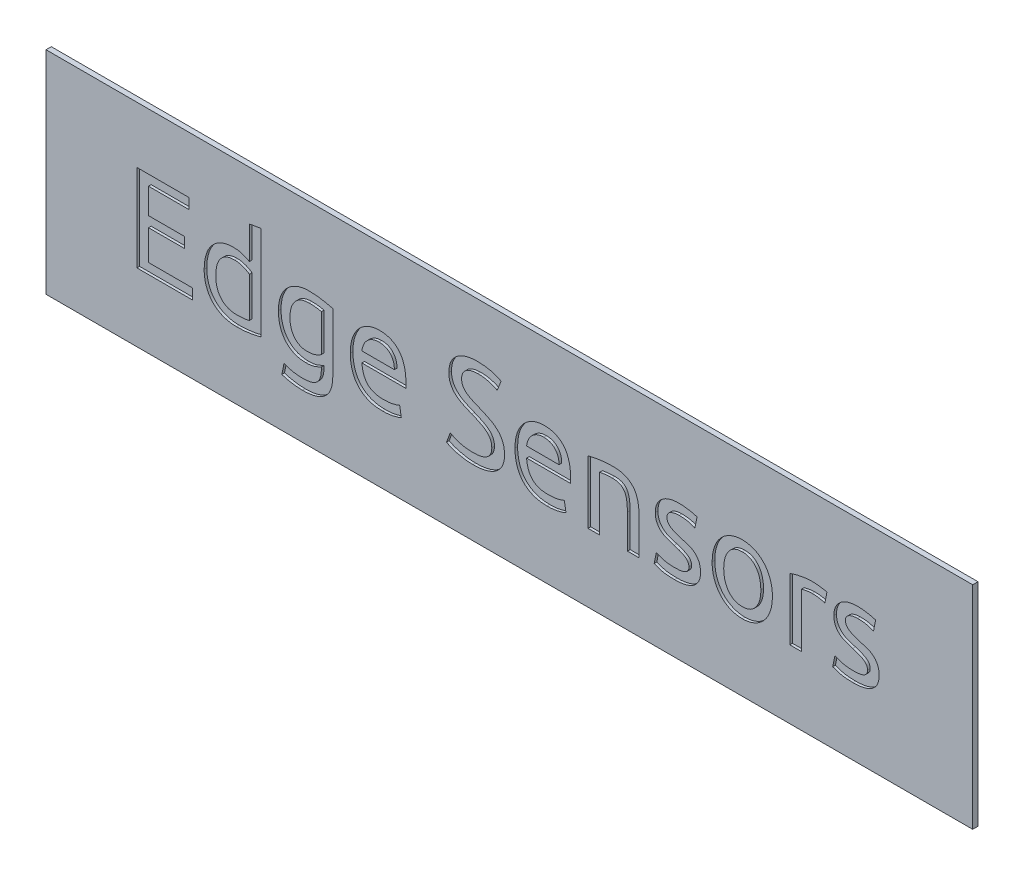
from build123d import *

# Parameters (mm, degrees)
SKETCH1_W           = 35
SKETCH1_H           = 8
BOSS_EXTRUDE1_DEPTH = 0.1
CUT_EXTRUDE4_DEPTH  = 0.1


with BuildPart() as part:
    # Sketch1 → Boss-Extrude1 (new, symmetric)
    with BuildSketch(Plane.XY):
        Rectangle(SKETCH1_W, SKETCH1_H)
    extrude(amount=BOSS_EXTRUDE1_DEPTH, both=True)

    # Sketch5 → Cut-Extrude4 (cut)
    # profile 1 of 11: a face of its own
    with BuildSketch(Plane.XY.offset(0.1)):
        Polygon((-14.067041447, -1.419015965), (-14.067041447, 1.866050701), (-12.096001447, 1.866050701), (-12.096001447, 1.471842701), (-13.629032559, 1.471842701), (-13.629032559, 0.508223146), (-12.271205003, 0.508223146), (-12.271205003, 0.114015146), (-13.629032559, 0.114015146), (-13.629032559, -1.024807965), (-11.964598781, -1.024807965), (-11.964598781, -1.419015965), align=None)
    # profile 2 of 11: a face of its own
    with BuildSketch(Plane.XY.offset(0.1)):
        with BuildLine():
            Line((-9.818355225, 2.141859424), (-9.380346336, 2.216457813))
            Line((-9.380346336, 2.216457813), (-9.380346336, -1.334836132))
            add(Edge.make_bspline(
                [(-9.380346336, -1.334836132), (-9.406991477, -1.342091811), (-9.463700055, -1.357533998), (-9.554735312, -1.37809044), (-9.656080821, -1.400420842), (-9.76759575, -1.421439016), (-9.888862732, -1.440554961), (-10.019372157, -1.45276812), (-10.158607818, -1.461446403), (-10.254296014, -1.462350919), (-10.303586947, -1.462816854)],
                knots=[0, 0, 0, 0, 0.708696399, 1.508311213, 2.394904626, 3.372161166, 4.420519196, 5.544381262, 6.735060893, 8, 8, 8, 8], degree=3))
            add(Edge.make_bspline(
                [(-10.303586947, -1.462816854), (-10.349258874, -1.461792162), (-10.438628961, -1.45978706), (-10.569345458, -1.443309992), (-10.692914742, -1.4149353), (-10.809763859, -1.377207436), (-10.918074268, -1.327372025), (-11.018879606, -1.268970343), (-11.111757832, -1.201259977), (-11.195480056, -1.123144953), (-11.271326454, -1.036884911), (-11.337279234, -0.940535125), (-11.394753972, -0.835849387), (-11.442923043, -0.722211876), (-11.480369392, -0.600416619), (-11.50669768, -0.470895455), (-11.523691085, -0.33425354), (-11.525608508, -0.240550571), (-11.526589892, -0.192591076)],
                knots=[0, 0, 0, 0, 1.100381898, 2.153209509, 3.16810763, 4.152085715, 5.106628803, 6.035383186, 6.955720103, 7.86991209, 8.789427673, 9.718116972, 10.677665349, 11.663009293, 12.687215338, 13.742752196, 14.844684807, 16, 16, 16, 16], degree=3))
            add(Edge.make_bspline(
                [(-11.526589892, -0.192591076), (-11.525651545, -0.146930302), (-11.523808065, -0.057224978), (-11.509860627, 0.07431348), (-11.487385608, 0.200163974), (-11.456087502, 0.319959747), (-11.415974246, 0.433049588), (-11.366738453, 0.53808696), (-11.308678987, 0.634654), (-11.243139998, 0.723360076), (-11.16870611, 0.803179781), (-11.086570465, 0.874053206), (-10.995749196, 0.934609417), (-10.89772179, 0.98612606), (-10.791802378, 1.027473617), (-10.67813909, 1.056909069), (-10.557097006, 1.073921706), (-10.474053478, 1.076378026), (-10.43156767, 1.077634701)],
                knots=[0, 0, 0, 0, 1.158390498, 2.275778191, 3.352141991, 4.39952402, 5.413834168, 6.392623011, 7.337677041, 8.268459554, 9.185881164, 10.101273583, 11.014760688, 11.94944075, 12.906122965, 13.893110212, 14.922096437, 16, 16, 16, 16], degree=3))
            add(Edge.make_bspline(
                [(-10.43156767, 1.077634701), (-10.397312192, 1.077099396), (-10.33089468, 1.076061499), (-10.234364461, 1.064560456), (-10.144011499, 1.047390576), (-10.060869951, 1.022338665), (-9.986359292, 0.994474692), (-9.920682181, 0.967165792), (-9.865430303, 0.940423489), (-9.833066984, 0.920891477), (-9.818355225, 0.91201259)],
                knots=[0, 0, 0, 0, 1.277617102, 2.477155621, 3.622424881, 4.705248139, 5.712558621, 6.590029649, 7.359053847, 8, 8, 8, 8], degree=3))
            Line((-9.818355225, 0.91201259), (-9.818355225, 2.141859424))
        make_face()
        with BuildLine():
            add(Edge.make_bspline(
                [(-9.818355225, 0.494535368), (-9.832961928, 0.505810652), (-9.864185806, 0.529913156), (-9.918675938, 0.561157423), (-9.98137687, 0.592931675), (-10.051839337, 0.623140797), (-10.128448821, 0.649814214), (-10.209605018, 0.670236967), (-10.294870596, 0.680715466), (-10.352838744, 0.682513262), (-10.38229167, 0.683426701)],
                knots=[0, 0, 0, 0, 0.731119519, 1.562870647, 2.485482577, 3.519124939, 4.600761002, 5.700226916, 6.831512668, 8, 8, 8, 8], degree=3))
            add(Edge.make_bspline(
                [(-10.38229167, 0.683426701), (-10.412904234, 0.682695652), (-10.471887259, 0.681287095), (-10.557131567, 0.66888547), (-10.635545468, 0.647833083), (-10.707076274, 0.618152319), (-10.772153915, 0.581658718), (-10.830606025, 0.538220486), (-10.883037348, 0.488627098), (-10.92918549, 0.432749997), (-10.968927875, 0.370834811), (-11.002388952, 0.303193108), (-11.030672842, 0.230441503), (-11.052120447, 0.152363745), (-11.068353045, 0.070412122), (-11.079688436, -0.014869379), (-11.087798722, -0.102780225), (-11.088318542, -0.16245893), (-11.088581003, -0.192591076)],
                knots=[0, 0, 0, 0, 1.147439195, 2.210838474, 3.221454076, 4.184157588, 5.107280873, 6.012351792, 6.907912923, 7.807143567, 8.723064634, 9.660348284, 10.632582249, 11.645476174, 12.692334412, 13.763003241, 14.870526556, 16, 16, 16, 16], degree=3))
            add(Edge.make_bspline(
                [(-11.088581003, -0.192591076), (-11.087882326, -0.22660153), (-11.086524272, -0.29270943), (-11.07720459, -0.389148272), (-11.060076493, -0.479296757), (-11.036664351, -0.563522247), (-11.007523785, -0.642279547), (-10.9705201, -0.714685039), (-10.926954435, -0.781264862), (-10.877097649, -0.841390879), (-10.821399663, -0.894925218), (-10.761146567, -0.941674309), (-10.696081983, -0.980989416), (-10.626847181, -1.013295576), (-10.552844906, -1.037973099), (-10.474654229, -1.05551116), (-10.391982486, -1.06697315), (-10.335336463, -1.068054849), (-10.306324503, -1.068608854)],
                knots=[0, 0, 0, 0, 1.227205659, 2.38538394, 3.491277341, 4.533808097, 5.536752352, 6.516006916, 7.46121355, 8.402397093, 9.328045612, 10.243499414, 11.148419069, 12.06542593, 12.994727378, 13.957231768, 14.953771049, 16, 16, 16, 16], degree=3))
            add(Edge.make_bspline(
                [(-10.306324503, -1.068608854), (-10.277580166, -1.068226968), (-10.222588358, -1.067496368), (-10.143576601, -1.065273311), (-10.072170126, -1.059559139), (-10.007804, -1.052779841), (-9.950732741, -1.044742972), (-9.900414787, -1.035467243), (-9.856821189, -1.027296427), (-9.830408442, -1.019948471), (-9.818355225, -1.016595299)],
                knots=[0, 0, 0, 0, 1.402022376, 2.682258534, 3.853849158, 4.89450926, 5.838561319, 6.663519747, 7.390109408, 8, 8, 8, 8], degree=3))
            Line((-9.818355225, -1.016595299), (-9.818355225, 0.494535368))
        make_face(mode=Mode.SUBTRACT)
    # profile 3 of 11: a face of its own
    with BuildSketch(Plane.XY.offset(0.1)):
        with BuildLine():
            add(Edge.make_bspline(
                [(-7.102700114, -1.175373521), (-7.113794957, -1.182136929), (-7.139704013, -1.197931072), (-7.186372582, -1.220822164), (-7.246420822, -1.24551569), (-7.317019888, -1.27443069), (-7.397795487, -1.300729877), (-7.487043837, -1.317493755), (-7.582328494, -1.330088378), (-7.648339219, -1.330963126), (-7.682377503, -1.331414187)],
                knots=[0, 0, 0, 0, 0.512896486, 1.197733363, 2.049348542, 3.076406364, 4.210256445, 5.395641772, 6.657068461, 8, 8, 8, 8], degree=3))
            add(Edge.make_bspline(
                [(-7.682377503, -1.331414187), (-7.71778773, -1.330773155), (-7.787743307, -1.329506748), (-7.890724839, -1.314976863), (-7.990623986, -1.29325059), (-8.087169299, -1.262783889), (-8.178869395, -1.222277955), (-8.265442063, -1.172980417), (-8.345099749, -1.112595031), (-8.419325507, -1.043436307), (-8.486775443, -0.964320257), (-8.545914217, -0.87540291), (-8.599288296, -0.778481769), (-8.643821754, -0.671607977), (-8.679295734, -0.554709627), (-8.705336398, -0.427620525), (-8.720083516, -0.289893286), (-8.722224293, -0.194679509), (-8.723333003, -0.145368243)],
                knots=[0, 0, 0, 0, 0.952404005, 1.88154606, 2.793260483, 3.70201361, 4.600986056, 5.486692861, 6.376984673, 7.284886975, 8.212587539, 9.167935918, 10.154347991, 11.186333508, 12.277862821, 13.437467191, 14.672862889, 16, 16, 16, 16], degree=3))
            add(Edge.make_bspline(
                [(-8.723333003, -0.145368243), (-8.722547895, -0.101514167), (-8.721009595, -0.015588664), (-8.704931533, 0.110391805), (-8.681850056, 0.231080505), (-8.647277846, 0.345787667), (-8.603681027, 0.454017124), (-8.550880118, 0.554845751), (-8.489663468, 0.648306322), (-8.418884291, 0.733409018), (-8.339324428, 0.810099827), (-8.251519443, 0.878525), (-8.155548426, 0.93825189), (-8.050809769, 0.988190368), (-7.938850184, 1.028707194), (-7.819293145, 1.057378473), (-7.693160918, 1.074784471), (-7.606695282, 1.076672209), (-7.562609447, 1.077634701)],
                knots=[0, 0, 0, 0, 1.107194599, 2.169382222, 3.203497529, 4.208095951, 5.190481787, 6.146795724, 7.078626211, 8.007583288, 8.93680845, 9.864781888, 10.814667073, 11.786397115, 12.79079717, 13.816722995, 14.886822624, 16, 16, 16, 16], degree=3))
            add(Edge.make_bspline(
                [(-7.562609447, 1.077634701), (-7.514234287, 1.0771371), (-7.420831432, 1.076176329), (-7.285367241, 1.068041418), (-7.159465514, 1.053959215), (-7.043019692, 1.033670766), (-6.935948926, 1.010975029), (-6.837349458, 0.991239061), (-6.748138884, 0.970154313), (-6.691608934, 0.956730397), (-6.664691225, 0.950338368)],
                knots=[0, 0, 0, 0, 1.276311119, 2.464304051, 3.579038617, 4.617095577, 5.581550006, 6.466934451, 7.270004451, 8, 8, 8, 8], degree=3))
            Line((-6.664691225, 0.950338368), (-6.664691225, -1.226018299))
            add(Edge.make_bspline(
                [(-6.664691225, -1.226018299), (-6.665698545, -1.271212963), (-6.667651407, -1.35883058), (-6.680129758, -1.485542418), (-6.703011612, -1.602424285), (-6.733153014, -1.710105143), (-6.773807717, -1.807854242), (-6.822919275, -1.896234424), (-6.881931488, -1.974473877), (-6.949494824, -2.043585368), (-7.026375866, -2.103446401), (-7.112024988, -2.155205407), (-7.207323547, -2.198160831), (-7.311678067, -2.233503877), (-7.424971639, -2.261571079), (-7.547439683, -2.281143662), (-7.679188595, -2.292689107), (-7.77018339, -2.294234968), (-7.817202114, -2.295033743)],
                knots=[0, 0, 0, 0, 1.19659051, 2.319796202, 3.365696097, 4.346291985, 5.274999128, 6.161979613, 7.015981777, 7.861613903, 8.713392099, 9.588636043, 10.504847559, 11.475103481, 12.501944304, 13.591169753, 14.755312055, 16, 16, 16, 16], degree=3))
            add(Edge.make_bspline(
                [(-7.817202114, -2.295033743), (-7.854403412, -2.294781814), (-7.927746028, -2.294285134), (-8.03593777, -2.286092621), (-8.141041745, -2.274857034), (-8.242372035, -2.258357662), (-8.338755939, -2.238353048), (-8.429267339, -2.217435093), (-8.513143904, -2.19433857), (-8.566226343, -2.176416011), (-8.591930336, -2.16773741)],
                knots=[0, 0, 0, 0, 1.13179536, 2.2313424, 3.300059131, 4.347802743, 5.353965189, 6.295287988, 7.174531036, 8, 8, 8, 8], degree=3))
            Line((-8.591930336, -2.16773741), (-8.511856836, -1.768738687))
            add(Edge.make_bspline(
                [(-8.511856836, -1.768738687), (-8.489347507, -1.777387017), (-8.442456081, -1.795403213), (-8.36778667, -1.819288808), (-8.286010406, -1.840578814), (-8.198535614, -1.862489041), (-8.10591905, -1.879019564), (-8.010236394, -1.891457082), (-7.912684059, -1.899107338), (-7.846872292, -1.900250784), (-7.81378017, -1.900825743)],
                knots=[0, 0, 0, 0, 0.80989454, 1.687171991, 2.631470454, 3.648147206, 4.715322053, 5.789380466, 6.888434464, 8, 8, 8, 8], degree=3))
            add(Edge.make_bspline(
                [(-7.81378017, -1.900825743), (-7.783417949, -1.900594482), (-7.724644156, -1.900146818), (-7.63990593, -1.892125108), (-7.561373859, -1.880980935), (-7.489783774, -1.864570127), (-7.424396105, -1.844363029), (-7.366269192, -1.81822681), (-7.314168059, -1.788027905), (-7.268290087, -1.752906303), (-7.22883683, -1.71191504), (-7.195168875, -1.665424937), (-7.166159712, -1.613863075), (-7.143137272, -1.556447863), (-7.124522346, -1.493953012), (-7.111746405, -1.425841642), (-7.104322083, -1.352339968), (-7.103252787, -1.301546981), (-7.102700114, -1.275294299)],
                knots=[0, 0, 0, 0, 1.328936581, 2.572494385, 3.723885676, 4.799830186, 5.78550224, 6.715595853, 7.584219763, 8.417427248, 9.236928635, 10.066114273, 10.924801483, 11.820795655, 12.76900571, 13.77601101, 14.850516998, 16, 16, 16, 16], degree=3))
            Line((-7.102700114, -1.275294299), (-7.102700114, -1.175373521))
        make_face()
        with BuildLine():
            add(Edge.make_bspline(
                [(-7.102700114, 0.631413146), (-7.114300686, 0.634743111), (-7.139153203, 0.64187707), (-7.179727108, 0.650304417), (-7.225504006, 0.659448257), (-7.277565684, 0.667513062), (-7.337015288, 0.675684744), (-7.405396975, 0.679533229), (-7.483173836, 0.683564709), (-7.538191925, 0.68347456), (-7.56740017, 0.683426701)],
                knots=[0, 0, 0, 0, 0.617145358, 1.322143002, 2.118560834, 3.00488278, 4.016610172, 5.186386036, 6.506296302, 8, 8, 8, 8], degree=3))
            add(Edge.make_bspline(
                [(-7.56740017, 0.683426701), (-7.595271266, 0.682858093), (-7.649871209, 0.681744179), (-7.729165245, 0.670468359), (-7.803533394, 0.652909841), (-7.872945907, 0.628044669), (-7.937336366, 0.595956984), (-7.996709398, 0.556470847), (-8.051399849, 0.510305797), (-8.100244649, 0.456779756), (-8.144223893, 0.397951643), (-8.181860646, 0.333726597), (-8.214138586, 0.265303543), (-8.240185289, 0.191890708), (-8.260715075, 0.114074504), (-8.274682625, 0.031599071), (-8.284088868, -0.055267258), (-8.284904657, -0.114772321), (-8.285324114, -0.145368243)],
                knots=[0, 0, 0, 0, 1.07736104, 2.110568209, 3.090722823, 4.028499335, 4.9557985, 5.86615153, 6.780131903, 7.716745435, 8.662622766, 9.615960654, 10.590898784, 11.584464587, 12.624580909, 13.699482217, 14.817134912, 16, 16, 16, 16], degree=3))
            add(Edge.make_bspline(
                [(-8.285324114, -0.145368243), (-8.284653115, -0.178926271), (-8.283358408, -0.243677209), (-8.273884859, -0.337096649), (-8.257775288, -0.423094371), (-8.234425242, -0.50139149), (-8.205387139, -0.572485615), (-8.171930509, -0.637258964), (-8.133395906, -0.695566371), (-8.091117701, -0.748001269), (-8.044132186, -0.793302244), (-7.993974479, -0.832667799), (-7.94022511, -0.865659043), (-7.883403732, -0.892629922), (-7.824036045, -0.91179085), (-7.763916814, -0.926467284), (-7.702973391, -0.935793471), (-7.661878232, -0.93673503), (-7.64131417, -0.937206187)],
                knots=[0, 0, 0, 0, 1.401586587, 2.704391556, 3.917284393, 5.05088594, 6.110844842, 7.120973542, 8.090930264, 9.025558841, 9.928562871, 10.811123483, 11.683855142, 12.557730551, 13.431605959, 14.284446384, 15.141535107, 16, 16, 16, 16], degree=3))
            add(Edge.make_bspline(
                [(-7.64131417, -0.937206187), (-7.613465472, -0.936433955), (-7.5587676, -0.934917208), (-7.478503213, -0.92640443), (-7.402003722, -0.910085508), (-7.329337088, -0.889428159), (-7.262385501, -0.863375691), (-7.201933452, -0.835461662), (-7.148630514, -0.805760842), (-7.11754251, -0.782628288), (-7.102700114, -0.771584076)],
                knots=[0, 0, 0, 0, 1.166470035, 2.291073993, 3.374005261, 4.438234581, 5.451280332, 6.378729272, 7.225954136, 8, 8, 8, 8], degree=3))
            Line((-7.102700114, -0.771584076), (-7.102700114, 0.631413146))
        make_face(mode=Mode.SUBTRACT)
    # profile 4 of 11: a face of its own
    with BuildSketch(Plane.XY.offset(0.1)):
        with BuildLine():
            add(Edge.make_bspline(
                [(-6.007677892, -0.177534521), (-6.006815491, -0.124778842), (-6.005137651, -0.022140245), (-5.986798466, 0.126189044), (-5.958568534, 0.264517864), (-5.917926008, 0.391994967), (-5.867945235, 0.509445038), (-5.80975158, 0.616350998), (-5.744563354, 0.713174084), (-5.671492256, 0.799157803), (-5.59206818, 0.875222031), (-5.506703614, 0.941601783), (-5.415257062, 0.997284487), (-5.318561849, 1.042079849), (-5.218733879, 1.077922153), (-5.116887473, 1.102942401), (-5.013766467, 1.118902284), (-4.944651843, 1.120588286), (-4.909918114, 1.12143559)],
                knots=[0, 0, 0, 0, 1.327468689, 2.582651294, 3.756340375, 4.87702492, 5.944853918, 6.965152771, 7.936836138, 8.878103736, 9.800182896, 10.700818157, 11.595168941, 12.48927997, 13.379379399, 14.261101673, 15.12611224, 16, 16, 16, 16], degree=3))
            add(Edge.make_bspline(
                [(-4.909918114, 1.12143559), (-4.870633692, 1.12056812), (-4.794070107, 1.118877459), (-4.682681035, 1.104224217), (-4.578288583, 1.080542912), (-4.480696198, 1.047081785), (-4.390823975, 1.002706062), (-4.306947451, 0.950197927), (-4.231636625, 0.886284879), (-4.162295457, 0.814118533), (-4.101410156, 0.731417129), (-4.048203157, 0.638749036), (-4.004073886, 0.53569647), (-3.968164762, 0.422817895), (-3.938948195, 0.300302324), (-3.920169281, 0.167402989), (-3.907297531, 0.024612844), (-3.905937674, -0.073932153), (-3.905235225, -0.124836576)],
                knots=[0, 0, 0, 0, 1.031932234, 2.011189882, 2.946219779, 3.841049608, 4.715055488, 5.574821978, 6.434463067, 7.30368639, 8.199298984, 9.125757528, 10.105748839, 11.138933968, 12.23528201, 13.411164626, 14.662710692, 16, 16, 16, 16], degree=3))
            add(Edge.make_bspline(
                [(-3.905235225, -0.124836576), (-3.905247535, -0.135558869), (-3.905275559, -0.159969195), (-3.905017471, -0.198526264), (-3.906053777, -0.239662875), (-3.908730211, -0.266971826), (-3.910025947, -0.280192854)],
                knots=[0, 0, 0, 0, 0.82729231, 1.883410153, 2.975299581, 4, 4, 4, 4], degree=3))
            Line((-3.910025947, -0.280192854), (-5.569669003, -0.280192854))
            add(Edge.make_bspline(
                [(-5.569669003, -0.280192854), (-5.566844219, -0.311487905), (-5.561338549, -0.372483787), (-5.547160559, -0.460847368), (-5.527164207, -0.543355029), (-5.502706304, -0.620079022), (-5.473500039, -0.691141117), (-5.438192565, -0.755768513), (-5.39848502, -0.815219641), (-5.35313468, -0.868789336), (-5.302258095, -0.916921936), (-5.243694179, -0.957236378), (-5.179272599, -0.992568893), (-5.107535068, -1.020220555), (-5.029637324, -1.042172166), (-4.945135182, -1.057888022), (-4.853973235, -1.066399012), (-4.791079342, -1.067857335), (-4.75866817, -1.068608854)],
                knots=[0, 0, 0, 0, 1.175258475, 2.290647397, 3.344218134, 4.348198022, 5.300733437, 6.213401868, 7.098646096, 7.970627488, 8.834089667, 9.710112565, 10.622780996, 11.576806211, 12.579079914, 13.646966454, 14.787408912, 16, 16, 16, 16], degree=3))
            add(Edge.make_bspline(
                [(-4.75866817, -1.068608854), (-4.722379528, -1.068080008), (-4.652457851, -1.067061017), (-4.552171219, -1.059450994), (-4.460544555, -1.047854763), (-4.378596123, -1.029418139), (-4.305850424, -1.009852012), (-4.242613694, -0.989570369), (-4.188451393, -0.971398976), (-4.156540136, -0.956831652), (-4.142033781, -0.950209576)],
                knots=[0, 0, 0, 0, 1.376383924, 2.652043942, 3.81348749, 4.87603448, 5.835393189, 6.67015634, 7.395473989, 8, 8, 8, 8], degree=3))
            Line((-4.142033781, -0.950209576), (-4.080438781, -1.325254687))
            add(Edge.make_bspline(
                [(-4.080438781, -1.325254687), (-4.095853379, -1.332555897), (-4.131040166, -1.349222313), (-4.192690029, -1.371187485), (-4.269053128, -1.39306262), (-4.357804714, -1.41750585), (-4.457699131, -1.437409893), (-4.565744995, -1.452584159), (-4.680497341, -1.461464821), (-4.759337065, -1.462358809), (-4.799731503, -1.462816854)],
                knots=[0, 0, 0, 0, 0.554579956, 1.265935475, 2.125279317, 3.138678044, 4.259297339, 5.435750784, 6.686177434, 8, 8, 8, 8], degree=3))
            add(Edge.make_bspline(
                [(-4.799731503, -1.462816854), (-4.850211616, -1.461729144), (-4.948108732, -1.459619724), (-5.089475025, -1.440705305), (-5.220627264, -1.411114393), (-5.340947899, -1.368676101), (-5.450360029, -1.314612924), (-5.550205938, -1.252413331), (-5.640148214, -1.180863621), (-5.719189048, -1.099306773), (-5.788563764, -1.009528486), (-5.847473586, -0.911019841), (-5.898692383, -0.805569018), (-5.938657731, -0.691507369), (-5.968901196, -0.57085817), (-5.991862529, -0.444716922), (-6.00465026, -0.312851096), (-6.006656458, -0.223186366), (-6.007677892, -0.177534521)],
                knots=[0, 0, 0, 0, 1.208119678, 2.34293118, 3.408190336, 4.422270291, 5.389613311, 6.324666099, 7.233999477, 8.133983449, 9.037490978, 9.944261645, 10.877493988, 11.839765712, 12.832016395, 13.853074316, 14.906915604, 16, 16, 16, 16], degree=3))
        make_face()
        with BuildLine():
            add(Edge.make_bspline(
                [(-4.343244114, 0.114015146), (-4.343362986, 0.135925987), (-4.343595062, 0.178703283), (-4.34961915, 0.241533322), (-4.361689339, 0.301112885), (-4.376891721, 0.358214243), (-4.398357597, 0.412139812), (-4.425436674, 0.462604591), (-4.455928396, 0.51112885), (-4.492461065, 0.555222447), (-4.532482157, 0.596021072), (-4.577445406, 0.630490786), (-4.624679712, 0.661558233), (-4.676872408, 0.685114365), (-4.731933459, 0.704597856), (-4.791079984, 0.717190241), (-4.853315425, 0.725804884), (-4.896198832, 0.726746181), (-4.918130781, 0.72722759)],
                knots=[0, 0, 0, 0, 1.106680256, 2.160610296, 3.182285172, 4.174944244, 5.142324458, 6.106403492, 7.065509454, 8.032134143, 8.993798923, 9.946024503, 10.889209428, 11.843107536, 12.830870189, 13.834707008, 14.892599795, 16, 16, 16, 16], degree=3))
            add(Edge.make_bspline(
                [(-4.918130781, 0.72722759), (-4.942793181, 0.726517131), (-4.990941071, 0.725130117), (-5.061088483, 0.715889443), (-5.126390142, 0.69851087), (-5.187133183, 0.675136468), (-5.242869125, 0.646166494), (-5.29503072, 0.613998823), (-5.342040054, 0.576983184), (-5.384711472, 0.536274179), (-5.423309909, 0.49253104), (-5.456836623, 0.444820328), (-5.486623366, 0.394185738), (-5.518499549, 0.322298105), (-5.551031239, 0.229546464), (-5.563480567, 0.152375874), (-5.569669003, 0.114015146)],
                knots=[0, 0, 0, 0, 1.049935956, 2.049768024, 3.003744765, 3.919900137, 4.814598855, 5.674138501, 6.525021604, 7.3561688, 8.182022917, 9.003870511, 9.835017706, 10.678106637, 12.348720051, 14, 14, 14, 14], degree=3))
            Line((-5.569669003, 0.114015146), (-4.343244114, 0.114015146))
        make_face(mode=Mode.SUBTRACT)
    # profile 5 of 11: a face of its own
    with BuildSketch(Plane.XY.offset(0.1)):
        with BuildLine():
            add(Edge.make_bspline(
                [(-1.372311947, -1.112409743), (-1.343780745, -1.112060325), (-1.288245638, -1.111380193), (-1.20788162, -1.104866426), (-1.132739491, -1.095982206), (-1.063598854, -1.081203594), (-0.999575396, -1.063816009), (-0.941150023, -1.041845684), (-0.888110609, -1.016170041), (-0.841304455, -0.985410917), (-0.798990551, -0.952297927), (-0.762960237, -0.913750394), (-0.732044782, -0.871612878), (-0.707591816, -0.824980381), (-0.686975337, -0.775296186), (-0.673863763, -0.720804178), (-0.665423371, -0.662576678), (-0.664461824, -0.622419038), (-0.663969447, -0.601855632)],
                knots=[0, 0, 0, 0, 1.377492973, 2.681247697, 3.891940251, 5.028431159, 6.092277143, 7.092864452, 8.038832474, 8.931122951, 9.793110516, 10.626971684, 11.47095992, 12.308886602, 13.164018022, 14.061800404, 15.007511787, 16, 16, 16, 16], degree=3))
            add(Edge.make_bspline(
                [(-0.663969447, -0.601855632), (-0.664854633, -0.576505852), (-0.66656198, -0.527611203), (-0.676894577, -0.456945931), (-0.69737593, -0.392804925), (-0.72406453, -0.333809364), (-0.758376041, -0.280203693), (-0.797324905, -0.230246567), (-0.841583848, -0.183657476), (-0.909481685, -0.127044318), (-1.004927701, -0.062076898), (-1.133485266, 0.003517263), (-1.272443604, 0.065491174), (-1.368366766, 0.106183259), (-1.417481614, 0.127018535)],
                knots=[0, 0, 0, 0, 0.811365835, 1.5649622, 2.276000999, 2.95859887, 3.630934483, 4.306944628, 4.983230544, 5.682292857, 7.131827656, 8.666343326, 10.293091724, 12, 12, 12, 12], degree=3))
            add(Edge.make_bspline(
                [(-1.417481614, 0.127018535), (-1.474435282, 0.149923176), (-1.58718076, 0.195265201), (-1.724731012, 0.256770048), (-1.829102869, 0.310369403), (-1.901239292, 0.354482848), (-1.968348343, 0.401622444), (-2.030668951, 0.452086372), (-2.085959463, 0.508117215), (-2.136849233, 0.567488504), (-2.179569604, 0.633356896), (-2.217997216, 0.70326266), (-2.248578663, 0.780075798), (-2.269322655, 0.86457821), (-2.282631495, 0.956302495), (-2.283931765, 1.020096868), (-2.284602336, 1.052996701)],
                knots=[0, 0, 0, 0, 1.881476714, 3.724571196, 4.615906794, 5.475721414, 6.3137665, 7.128471691, 7.929438621, 8.723539643, 9.520590439, 10.330872839, 11.165761655, 12.045919756, 12.992247868, 14, 14, 14, 14], degree=3))
            add(Edge.make_bspline(
                [(-2.284602336, 1.052996701), (-2.283610085, 1.087483121), (-2.281677417, 1.154654396), (-2.268731482, 1.252660745), (-2.246225028, 1.345002535), (-2.213997184, 1.431236467), (-2.173233438, 1.511662649), (-2.123596841, 1.586271747), (-2.064428431, 1.654898105), (-1.996181651, 1.717229579), (-1.920623916, 1.773207948), (-1.837361775, 1.821449176), (-1.747716979, 1.862363583), (-1.651069418, 1.896123512), (-1.547703813, 1.921865132), (-1.437375617, 1.940002143), (-1.320571027, 1.952180795), (-1.2402572, 1.953154332), (-1.199161559, 1.953652479)],
                knots=[0, 0, 0, 0, 1.036936748, 2.019704159, 2.966376421, 3.888880766, 4.781625726, 5.672022014, 6.576782996, 7.499210823, 8.445883085, 9.398871932, 10.387273209, 11.404763735, 12.472884254, 13.585964168, 14.764766231, 16, 16, 16, 16], degree=3))
            add(Edge.make_bspline(
                [(-1.199161559, 1.953652479), (-1.151234444, 1.952816305), (-1.057516548, 1.951181229), (-0.920251767, 1.93981033), (-0.789993808, 1.919106911), (-0.668029723, 1.891382321), (-0.557786373, 1.858699013), (-0.461041592, 1.825907163), (-0.380593293, 1.790423446), (-0.334546358, 1.762451616), (-0.313562336, 1.74970459)],
                knots=[0, 0, 0, 0, 1.25147498, 2.447165896, 3.593012675, 4.692731984, 5.710660103, 6.594242178, 7.359382933, 8, 8, 8, 8], degree=3))
            Line((-0.313562336, 1.74970459), (-0.460021559, 1.379450201))
            add(Edge.make_bspline(
                [(-0.460021559, 1.379450201), (-0.477863438, 1.390058468), (-0.516429113, 1.412988505), (-0.583074922, 1.442392222), (-0.660918398, 1.472389335), (-0.749829466, 1.50152758), (-0.848210126, 1.528029173), (-0.955705152, 1.54577379), (-1.070668108, 1.558035784), (-1.150078384, 1.558965815), (-1.190948892, 1.559444479)],
                knots=[0, 0, 0, 0, 0.653649503, 1.412879949, 2.2914092, 3.282670824, 4.360349048, 5.49858183, 6.712581845, 8, 8, 8, 8], degree=3))
            add(Edge.make_bspline(
                [(-1.190948892, 1.559444479), (-1.23235127, 1.558327583), (-1.313038099, 1.556150925), (-1.428365056, 1.533725583), (-1.533274595, 1.499198938), (-1.60964712, 1.455916072), (-1.663057971, 1.415226438), (-1.698182013, 1.380709422), (-1.729148408, 1.34209004), (-1.755823673, 1.299767917), (-1.777600504, 1.253773121), (-1.791406814, 1.203241621), (-1.801750834, 1.149460416), (-1.802439916, 1.111908664), (-1.802792559, 1.092691257)],
                knots=[0, 0, 0, 0, 1.719475256, 3.350991228, 4.86583626, 6.292971001, 6.9759855, 7.653444794, 8.334876713, 9.02964567, 9.729896761, 10.441301586, 11.202323736, 12, 12, 12, 12], degree=3))
            add(Edge.make_bspline(
                [(-1.802792559, 1.092691257), (-1.802078664, 1.07121681), (-1.800712642, 1.030125917), (-1.791893781, 0.9707488), (-1.776421209, 0.91679619), (-1.754088915, 0.867759428), (-1.725356617, 0.823729737), (-1.692118457, 0.782474766), (-1.654695232, 0.743044589), (-1.59522591, 0.695203001), (-1.510759871, 0.63949618), (-1.396377237, 0.579914775), (-1.268349306, 0.52368525), (-1.178290077, 0.487861895), (-1.131407059, 0.469212979)],
                knots=[0, 0, 0, 0, 0.785038728, 1.502154768, 2.188344236, 2.830229253, 3.464100274, 4.104900842, 4.765475595, 5.446731494, 6.890051486, 8.456936281, 10.155552478, 12, 12, 12, 12], degree=3))
            add(Edge.make_bspline(
                [(-1.131407059, 0.469212979), (-1.065271315, 0.441166513), (-0.937224111, 0.386864991), (-0.782708874, 0.313637937), (-0.667612711, 0.253009921), (-0.588609054, 0.20381841), (-0.516007446, 0.149573034), (-0.449142926, 0.0912627), (-0.388509848, 0.028142242), (-0.334610585, -0.040584608), (-0.288766175, -0.115580317), (-0.250108169, -0.196465598), (-0.218580316, -0.284531416), (-0.1973753, -0.381329202), (-0.18410289, -0.486735558), (-0.182823301, -0.559836846), (-0.18215967, -0.597749299)],
                knots=[0, 0, 0, 0, 1.95273218, 3.780737635, 4.64641346, 5.487847706, 6.307705496, 7.107546074, 7.897078186, 8.683584325, 9.477052339, 10.281471897, 11.117058081, 12.013722982, 12.969858994, 14, 14, 14, 14], degree=3))
            add(Edge.make_bspline(
                [(-0.18215967, -0.597749299), (-0.183043243, -0.633157927), (-0.184766794, -0.702228134), (-0.199250894, -0.802811185), (-0.22376637, -0.896987016), (-0.258434591, -0.984884253), (-0.302106875, -1.066746154), (-0.356206583, -1.141954547), (-0.419674318, -1.211116713), (-0.493238495, -1.272916884), (-0.574723398, -1.328926462), (-0.665575679, -1.3756721), (-0.763191597, -1.417218011), (-0.869786122, -1.44960572), (-0.983605896, -1.475836446), (-1.105932663, -1.492741797), (-1.235632526, -1.5052391), (-1.325055809, -1.506150209), (-1.37094317, -1.506617743)],
                knots=[0, 0, 0, 0, 1.002359664, 1.955263247, 2.87036426, 3.752111736, 4.625011069, 5.490901748, 6.36873565, 7.276165365, 8.206127549, 9.162637605, 10.164476677, 11.20656157, 12.313001129, 13.468736406, 14.701087669, 16, 16, 16, 16], degree=3))
            add(Edge.make_bspline(
                [(-1.37094317, -1.506617743), (-1.432363969, -1.505328579), (-1.550504339, -1.502848924), (-1.719560886, -1.483444675), (-1.87171789, -1.453884779), (-2.007313619, -1.422190881), (-2.124818103, -1.384606695), (-2.211482763, -1.352083063), (-2.271571091, -1.325704073), (-2.309140383, -1.306575498), (-2.342677771, -1.290822921), (-2.362897527, -1.279720187), (-2.372204114, -1.27460991)],
                knots=[0, 0, 0, 0, 1.77521498, 3.414552703, 4.9110395, 6.254623107, 7.437219514, 8.474610623, 8.929266385, 9.333326447, 9.693148859, 10, 10, 10, 10], degree=3))
            Line((-2.372204114, -1.27460991), (-2.234641947, -0.899564799))
            add(Edge.make_bspline(
                [(-2.234641947, -0.899564799), (-2.21445285, -0.910291453), (-2.170180814, -0.933813596), (-2.095184229, -0.966745521), (-2.006715278, -1.002339931), (-1.905093037, -1.039511404), (-1.789850148, -1.072994354), (-1.661347304, -1.095184161), (-1.520945477, -1.110062759), (-1.423228145, -1.111605756), (-1.372311947, -1.112409743)],
                knots=[0, 0, 0, 0, 0.610817719, 1.339442905, 2.18743935, 3.159432638, 4.230564173, 5.389377797, 6.639719769, 8, 8, 8, 8], degree=3))
        make_face()
    # profile 6 of 11: a face of its own
    with BuildSketch(Plane.XY.offset(0.1)):
        with BuildLine():
            add(Edge.make_bspline(
                [(0.21204833, -0.177534521), (0.212910731, -0.124778842), (0.214588571, -0.022140245), (0.232927756, 0.126189044), (0.261157688, 0.264517864), (0.301800214, 0.391994967), (0.351780987, 0.509445038), (0.409974642, 0.616350998), (0.475162868, 0.713174084), (0.548233967, 0.799157803), (0.627658042, 0.875222031), (0.713022608, 0.941601783), (0.80446916, 0.997284487), (0.901164373, 1.042079849), (1.000992343, 1.077922153), (1.10283875, 1.102942401), (1.205959756, 1.118902284), (1.275074379, 1.120588286), (1.309808108, 1.12143559)],
                knots=[0, 0, 0, 0, 1.327468689, 2.582651294, 3.756340375, 4.87702492, 5.944853918, 6.965152771, 7.936836138, 8.878103736, 9.800182896, 10.700818157, 11.595168941, 12.48927997, 13.379379399, 14.261101673, 15.12611224, 16, 16, 16, 16], degree=3))
            add(Edge.make_bspline(
                [(1.309808108, 1.12143559), (1.34909253, 1.12056812), (1.425656115, 1.118877459), (1.537045188, 1.104224217), (1.641437639, 1.080542912), (1.739030024, 1.047081785), (1.828902247, 1.002706062), (1.912778771, 0.950197927), (1.988089597, 0.886284879), (2.057430765, 0.814118533), (2.118316066, 0.731417129), (2.171523066, 0.638749036), (2.215652336, 0.53569647), (2.25156146, 0.422817895), (2.280778027, 0.300302324), (2.299556942, 0.167402989), (2.312428691, 0.024612844), (2.313788549, -0.073932153), (2.314490997, -0.124836576)],
                knots=[0, 0, 0, 0, 1.031932234, 2.011189882, 2.946219779, 3.841049608, 4.715055488, 5.574821978, 6.434463067, 7.30368639, 8.199298984, 9.125757528, 10.105748839, 11.138933968, 12.23528201, 13.411164626, 14.662710692, 16, 16, 16, 16], degree=3))
            add(Edge.make_bspline(
                [(2.314490997, -0.124836576), (2.314478687, -0.135558869), (2.314450664, -0.159969195), (2.314708751, -0.198526264), (2.313672445, -0.239662875), (2.310996011, -0.266971826), (2.309700275, -0.280192854)],
                knots=[0, 0, 0, 0, 0.82729231, 1.883410153, 2.975299581, 4, 4, 4, 4], degree=3))
            Line((2.309700275, -0.280192854), (0.650057219, -0.280192854))
            add(Edge.make_bspline(
                [(0.650057219, -0.280192854), (0.652882003, -0.311487905), (0.658387673, -0.372483787), (0.672565663, -0.460847368), (0.692562015, -0.543355029), (0.717019919, -0.620079022), (0.746226183, -0.691141117), (0.781533657, -0.755768513), (0.821241202, -0.815219641), (0.866591542, -0.868789336), (0.917468127, -0.916921936), (0.976032043, -0.957236378), (1.040453624, -0.992568893), (1.112191154, -1.020220555), (1.190088898, -1.042172166), (1.27459104, -1.057888022), (1.365752987, -1.066399012), (1.428646881, -1.067857335), (1.461058053, -1.068608854)],
                knots=[0, 0, 0, 0, 1.175258475, 2.290647397, 3.344218134, 4.348198022, 5.300733437, 6.213401868, 7.098646096, 7.970627488, 8.834089667, 9.710112565, 10.622780996, 11.576806211, 12.579079914, 13.646966454, 14.787408912, 16, 16, 16, 16], degree=3))
            add(Edge.make_bspline(
                [(1.461058053, -1.068608854), (1.497346694, -1.068080008), (1.567268371, -1.067061017), (1.667555003, -1.059450994), (1.759181667, -1.047854763), (1.841130099, -1.029418139), (1.913875799, -1.009852012), (1.977112528, -0.989570369), (2.03127483, -0.971398976), (2.063186086, -0.956831652), (2.077692441, -0.950209576)],
                knots=[0, 0, 0, 0, 1.376383924, 2.652043942, 3.81348749, 4.87603448, 5.835393189, 6.67015634, 7.395473989, 8, 8, 8, 8], degree=3))
            Line((2.077692441, -0.950209576), (2.139287441, -1.325254687))
            add(Edge.make_bspline(
                [(2.139287441, -1.325254687), (2.123872843, -1.332555897), (2.088686056, -1.349222313), (2.027036193, -1.371187485), (1.950673095, -1.39306262), (1.861921509, -1.41750585), (1.762027092, -1.437409893), (1.653981227, -1.452584159), (1.539228881, -1.461464821), (1.460389158, -1.462358809), (1.419994719, -1.462816854)],
                knots=[0, 0, 0, 0, 0.554579956, 1.265935475, 2.125279317, 3.138678044, 4.259297339, 5.435750784, 6.686177434, 8, 8, 8, 8], degree=3))
            add(Edge.make_bspline(
                [(1.419994719, -1.462816854), (1.369514606, -1.461729144), (1.27161749, -1.459619724), (1.130251197, -1.440705305), (0.999098958, -1.411114393), (0.878778323, -1.368676101), (0.769366193, -1.314612924), (0.669520284, -1.252413331), (0.579578008, -1.180863621), (0.500537174, -1.099306773), (0.431162458, -1.009528486), (0.372252636, -0.911019841), (0.321033839, -0.805569018), (0.281068491, -0.691507369), (0.250825026, -0.57085817), (0.227863693, -0.444716922), (0.215075963, -0.312851096), (0.213069765, -0.223186366), (0.21204833, -0.177534521)],
                knots=[0, 0, 0, 0, 1.208119678, 2.34293118, 3.408190336, 4.422270291, 5.389613311, 6.324666099, 7.233999477, 8.133983449, 9.037490978, 9.944261645, 10.877493988, 11.839765712, 12.832016395, 13.853074316, 14.906915604, 16, 16, 16, 16], degree=3))
        make_face()
        with BuildLine():
            add(Edge.make_bspline(
                [(1.876482108, 0.114015146), (1.876363237, 0.135925987), (1.87613116, 0.178703283), (1.870107072, 0.241533322), (1.858036884, 0.301112885), (1.842834502, 0.358214243), (1.821368625, 0.412139812), (1.794289548, 0.462604591), (1.763797827, 0.51112885), (1.727265157, 0.555222447), (1.687244065, 0.596021072), (1.642280816, 0.630490786), (1.595046511, 0.661558233), (1.542853815, 0.685114365), (1.487792763, 0.704597856), (1.428646238, 0.717190241), (1.366410797, 0.725804884), (1.32352739, 0.726746181), (1.301595441, 0.72722759)],
                knots=[0, 0, 0, 0, 1.106680256, 2.160610296, 3.182285172, 4.174944244, 5.142324458, 6.106403492, 7.065509454, 8.032134143, 8.993798923, 9.946024503, 10.889209428, 11.843107536, 12.830870189, 13.834707008, 14.892599795, 16, 16, 16, 16], degree=3))
            add(Edge.make_bspline(
                [(1.301595441, 0.72722759), (1.276933041, 0.726517131), (1.228785152, 0.725130117), (1.158637739, 0.715889443), (1.09333608, 0.69851087), (1.032593039, 0.675136468), (0.976857097, 0.646166494), (0.924695502, 0.613998823), (0.877686169, 0.576983184), (0.83501475, 0.536274179), (0.796416314, 0.49253104), (0.762889599, 0.444820328), (0.733102857, 0.394185738), (0.701226673, 0.322298105), (0.668694983, 0.229546464), (0.656245655, 0.152375874), (0.650057219, 0.114015146)],
                knots=[0, 0, 0, 0, 1.049935956, 2.049768024, 3.003744765, 3.919900137, 4.814598855, 5.674138501, 6.525021604, 7.3561688, 8.182022917, 9.003870511, 9.835017706, 10.678106637, 12.348720051, 14, 14, 14, 14], degree=3))
            Line((0.650057219, 0.114015146), (1.876482108, 0.114015146))
        make_face(mode=Mode.SUBTRACT)
    # profile 7 of 11: a face of its own
    with BuildSketch(Plane.XY.offset(0.1)):
        with BuildLine():
            add(Edge.make_bspline(
                [(2.97150433, 0.95512909), (2.997939302, 0.961635056), (3.054745907, 0.975615845), (3.146236111, 0.995357277), (3.250011413, 1.014644001), (3.364631799, 1.036639593), (3.490368387, 1.054989646), (3.62574233, 1.068806927), (3.770564745, 1.075937064), (3.870100162, 1.077057058), (3.921436108, 1.077634701)],
                knots=[0, 0, 0, 0, 0.680284324, 1.461875666, 2.338427445, 3.317936278, 4.378115673, 5.512616965, 6.717118313, 8, 8, 8, 8], degree=3))
            add(Edge.make_bspline(
                [(3.921436108, 1.077634701), (3.966891437, 1.076935355), (4.054223723, 1.075591715), (4.17879636, 1.059378911), (4.291851117, 1.034996604), (4.392630865, 0.998057025), (4.482990176, 0.952934703), (4.563584013, 0.898963347), (4.634291841, 0.836429915), (4.695839504, 0.765940979), (4.748088154, 0.687452397), (4.792865001, 0.602126791), (4.827392999, 0.508483553), (4.854751393, 0.408612573), (4.873820683, 0.302436267), (4.888262724, 0.190984195), (4.897411008, 0.074245163), (4.898293782, -0.005507904), (4.898743441, -0.046131854)],
                knots=[0, 0, 0, 0, 1.270490605, 2.440964561, 3.507431799, 4.498454317, 5.434378614, 6.326270354, 7.203202198, 8.066919966, 8.935806928, 9.834745711, 10.755519173, 11.721390489, 12.727517542, 13.769795289, 14.863996961, 16, 16, 16, 16], degree=3))
            Line((4.898743441, -0.046131854), (4.898743441, -1.419015965))
            Line((4.898743441, -1.419015965), (4.460734553, -1.419015965))
            Line((4.460734553, -1.419015965), (4.460734553, -0.145368243))
            add(Edge.make_bspline(
                [(4.460734553, -0.145368243), (4.460328054, -0.109315487), (4.459545435, -0.039904196), (4.453946313, 0.06031555), (4.445553546, 0.152429737), (4.432618761, 0.236576065), (4.415558885, 0.312737264), (4.395026218, 0.381669188), (4.368096006, 0.442460533), (4.336419462, 0.495809134), (4.299959033, 0.542462034), (4.257417452, 0.582053776), (4.20941055, 0.615212106), (4.154887613, 0.640639504), (4.094462166, 0.659481593), (4.02810498, 0.673986805), (3.954710041, 0.681993742), (3.90366085, 0.682934485), (3.87695083, 0.683426701)],
                knots=[0, 0, 0, 0, 1.468089658, 2.826469009, 4.086424813, 5.233471078, 6.290495501, 7.263113516, 8.157324361, 8.990583806, 9.784215768, 10.559808284, 11.348312596, 12.150328132, 12.999388289, 13.921397661, 14.912431199, 16, 16, 16, 16], degree=3))
            add(Edge.make_bspline(
                [(3.87695083, 0.683426701), (3.854134988, 0.683092973), (3.807568012, 0.682411837), (3.737716093, 0.679090593), (3.66841205, 0.67326148), (3.602180389, 0.66754416), (3.540754194, 0.660155725), (3.48719424, 0.651439583), (3.444123717, 0.643378409), (3.419545617, 0.638283522), (3.409513219, 0.636203868)],
                knots=[0, 0, 0, 0, 1.163702551, 2.37510882, 3.565492602, 4.710491206, 5.765406209, 6.719877075, 7.477473773, 8, 8, 8, 8], degree=3))
            Line((3.409513219, 0.636203868), (3.409513219, -1.419015965))
            Line((3.409513219, -1.419015965), (2.97150433, -1.419015965))
            Line((2.97150433, -1.419015965), (2.97150433, 0.95512909))
        make_face()
    # profile 8 of 11: a face of its own
    with BuildSketch(Plane.XY.offset(0.1)):
        with BuildLine():
            add(Edge.make_bspline(
                [(6.242883219, -1.068608854), (6.265012375, -1.068226108), (6.307917503, -1.067484021), (6.370059146, -1.065208131), (6.427596198, -1.059613871), (6.480568516, -1.052079117), (6.529410611, -1.042895734), (6.573551788, -1.030268485), (6.613776203, -1.017139925), (6.659266935, -0.99545702), (6.708397092, -0.963499813), (6.752454231, -0.911536418), (6.777997417, -0.847849503), (6.780751556, -0.802155113), (6.782181664, -0.778427965)],
                knots=[0, 0, 0, 0, 1.15783728, 2.244873574, 3.251859722, 4.180101662, 5.043725828, 5.848624977, 6.580788869, 7.253443454, 8.481479101, 9.616771655, 10.762491124, 12, 12, 12, 12], degree=3))
            add(Edge.make_bspline(
                [(6.782181664, -0.778427965), (6.780718223, -0.753562043), (6.777861369, -0.705020045), (6.752006776, -0.636855173), (6.709993371, -0.57698101), (6.64942393, -0.526448058), (6.571218867, -0.480651226), (6.474909893, -0.434455953), (6.357340711, -0.38980779), (6.271764495, -0.362135052), (6.225773497, -0.347262965)],
                knots=[0, 0, 0, 0, 0.786255881, 1.53488906, 2.277624633, 3.082861666, 4.014797129, 5.147466321, 6.46697041, 8, 8, 8, 8], degree=3))
            add(Edge.make_bspline(
                [(6.225773497, -0.347262965), (6.179248854, -0.332407013), (6.088059003, -0.30328885), (5.975124892, -0.26768246), (5.889707534, -0.234020399), (5.829929821, -0.204255719), (5.775235935, -0.168102706), (5.724128989, -0.128597638), (5.67805471, -0.083790622), (5.636952363, -0.034339393), (5.600637939, 0.019354989), (5.56837759, 0.077306566), (5.542970015, 0.141655972), (5.52467, 0.212407053), (5.513530145, 0.29000658), (5.51249519, 0.343930531), (5.511955886, 0.372029757)],
                knots=[0, 0, 0, 0, 1.843805769, 3.613920779, 4.467868233, 5.3074523, 6.129135207, 6.93881679, 7.742707307, 8.549820213, 9.361925381, 10.186671254, 11.048614442, 11.965587033, 12.939887954, 14, 14, 14, 14], degree=3))
            add(Edge.make_bspline(
                [(5.511955886, 0.372029757), (5.512829647, 0.400121459), (5.514534257, 0.454925214), (5.525366689, 0.535088029), (5.544601727, 0.610566508), (5.571305763, 0.681595073), (5.605917517, 0.747906055), (5.647981154, 0.809870663), (5.697458608, 0.867595495), (5.754419269, 0.920406582), (5.818368396, 0.967242862), (5.887236365, 1.009631497), (5.962865535, 1.043301309), (6.042921273, 1.072629166), (6.129099542, 1.093807426), (6.220164137, 1.110888557), (6.317103107, 1.119132783), (6.383400183, 1.120654922), (6.417402386, 1.12143559)],
                knots=[0, 0, 0, 0, 1.016902755, 1.983862999, 2.921173698, 3.830644198, 4.724459732, 5.622271565, 6.535856491, 7.470763359, 8.427015907, 9.401352539, 10.391620572, 11.418133962, 12.483631114, 13.599641033, 14.768912642, 16, 16, 16, 16], degree=3))
            add(Edge.make_bspline(
                [(6.417402386, 1.12143559), (6.452334086, 1.121055076), (6.522331438, 1.120292588), (6.625885604, 1.109632621), (6.725822847, 1.096969349), (6.819215787, 1.082102779), (6.903757797, 1.065406499), (6.977167294, 1.046593128), (7.038268324, 1.030683244), (7.073564791, 1.018061443), (7.088787886, 1.012617757)],
                knots=[0, 0, 0, 0, 1.227245651, 2.459197417, 3.655670828, 4.768275572, 5.782572861, 6.683001387, 7.431988628, 8, 8, 8, 8], degree=3))
            Line((7.088787886, 1.012617757), (7.007345608, 0.608828313))
            add(Edge.make_bspline(
                [(7.007345608, 0.608828313), (6.993760033, 0.61545586), (6.963748228, 0.630096732), (6.912076261, 0.64834686), (6.850881445, 0.668607413), (6.779893495, 0.687940999), (6.700027049, 0.706444837), (6.611580182, 0.717961889), (6.515408775, 0.725707991), (6.448673738, 0.726707815), (6.413980441, 0.72722759)],
                knots=[0, 0, 0, 0, 0.594232223, 1.312714502, 2.152798186, 3.130424983, 4.206081816, 5.37503699, 6.635370234, 8, 8, 8, 8], degree=3))
            add(Edge.make_bspline(
                [(6.413980441, 0.72722759), (6.383803812, 0.726626578), (6.325168135, 0.72545876), (6.240542712, 0.711045686), (6.161449805, 0.689561571), (6.100586803, 0.663240154), (6.056427062, 0.63805949), (6.027789948, 0.616562523), (6.003758014, 0.592658339), (5.983926161, 0.565996872), (5.969099051, 0.536469791), (5.958015491, 0.504511567), (5.950908342, 0.470208966), (5.950283489, 0.446435245), (5.949964775, 0.434309146)],
                knots=[0, 0, 0, 0, 1.77075498, 3.440722779, 5.027479546, 6.575973499, 7.320662601, 8.009477859, 8.672792211, 9.305340879, 9.952623164, 10.60529323, 11.28861149, 12, 12, 12, 12], degree=3))
            add(Edge.make_bspline(
                [(5.949964775, 0.434309146), (5.951522793, 0.409930874), (5.954540725, 0.362709345), (5.978820899, 0.295644397), (6.020710119, 0.236934403), (6.079170364, 0.185310663), (6.154188483, 0.140216798), (6.243860231, 0.096803418), (6.35125583, 0.057633653), (6.429124087, 0.034619784), (6.470784719, 0.022307035)],
                knots=[0, 0, 0, 0, 0.815586627, 1.579818556, 2.353967354, 3.209225148, 4.174421955, 5.278881429, 6.544162623, 8, 8, 8, 8], degree=3))
            add(Edge.make_bspline(
                [(6.470784719, 0.022307035), (6.526322986, 0.005530257), (6.631795603, -0.02633049), (6.758828775, -0.069497998), (6.851058287, -0.106356209), (6.913048449, -0.138410341), (6.969083623, -0.176358521), (7.020369015, -0.218134434), (7.065693528, -0.265265481), (7.106467724, -0.316447044), (7.14065053, -0.373236608), (7.169789659, -0.434518785), (7.192436922, -0.501811976), (7.208882572, -0.575629666), (7.218202261, -0.656596749), (7.219511406, -0.712930858), (7.220190553, -0.742155354)],
                knots=[0, 0, 0, 0, 2.060696276, 3.91346439, 4.763668227, 5.586398343, 6.386470506, 7.163562113, 7.931431393, 8.704668964, 9.482900404, 10.280342096, 11.110579717, 11.99914976, 12.962017139, 14, 14, 14, 14], degree=3))
            add(Edge.make_bspline(
                [(7.220190553, -0.742155354), (7.219385156, -0.770938181), (7.217818574, -0.826923828), (7.206166365, -0.908227025), (7.186386187, -0.984079134), (7.158298593, -1.054583867), (7.121387768, -1.11930353), (7.077796903, -1.179507408), (7.02475002, -1.232995924), (6.965036462, -1.281871696), (6.897728587, -1.32499368), (6.823188036, -1.361817604), (6.742199672, -1.393476661), (6.654102145, -1.41845473), (6.559411441, -1.438259695), (6.457889349, -1.452333971), (6.349590365, -1.461559321), (6.275069561, -1.462389614), (6.236723719, -1.462816854)],
                knots=[0, 0, 0, 0, 0.998960589, 1.943084175, 2.843970279, 3.714551504, 4.56913739, 5.424456827, 6.286895681, 7.176185894, 8.098808081, 9.055043292, 10.058013773, 11.113182342, 12.229913844, 13.413707883, 14.669183074, 16, 16, 16, 16], degree=3))
            add(Edge.make_bspline(
                [(6.236723719, -1.462816854), (6.184913652, -1.462271718), (6.086883745, -1.461240265), (5.94892153, -1.450759117), (5.828278561, -1.435743147), (5.725975829, -1.411207522), (5.640707634, -1.384327464), (5.569965266, -1.361814523), (5.513861775, -1.343168595), (5.481805066, -1.330604574), (5.468154997, -1.325254687)],
                knots=[0, 0, 0, 0, 1.580865433, 2.991157899, 4.220996093, 5.286641676, 6.196277926, 6.949320497, 7.552610115, 8, 8, 8, 8], degree=3))
            Line((5.468154997, -1.325254687), (5.550281664, -0.926940354))
            add(Edge.make_bspline(
                [(5.550281664, -0.926940354), (5.564860287, -0.93224925), (5.598013653, -0.944322253), (5.653760841, -0.962820113), (5.720575368, -0.986596751), (5.798538737, -1.013845637), (5.890016624, -1.039197677), (5.995551382, -1.055919101), (6.114658103, -1.067178128), (6.198595289, -1.068114693), (6.242883219, -1.068608854)],
                knots=[0, 0, 0, 0, 0.52280997, 1.188926367, 1.97910038, 2.912623562, 3.971860929, 5.17249786, 6.508119917, 8, 8, 8, 8], degree=3))
        make_face()
    # profile 9 of 11: a face of its own
    with BuildSketch(Plane.XY.offset(0.1)):
        with BuildLine():
            add(Edge.make_bspline(
                [(9.935845664, -0.170690632), (9.934798435, -0.218416489), (9.932748182, -0.311853701), (9.916577995, -0.448490284), (9.891124893, -0.578287115), (9.854050717, -0.700353391), (9.807107387, -0.814359794), (9.75272055, -0.920751258), (9.689128137, -1.018828526), (9.617563463, -1.108457942), (9.537766708, -1.188761905), (9.450971477, -1.260187861), (9.356055032, -1.320891259), (9.25469344, -1.372543013), (9.147226746, -1.412869559), (9.034537317, -1.441493046), (8.917411712, -1.460128811), (8.837473064, -1.461913677), (8.797022553, -1.462816854)],
                knots=[0, 0, 0, 0, 1.185427197, 2.320817697, 3.413459331, 4.46772175, 5.484447204, 6.473059413, 7.432031974, 8.383572742, 9.317376461, 10.239758134, 11.170460651, 12.110846087, 13.061441123, 14.015459976, 14.995784116, 16, 16, 16, 16], degree=3))
            add(Edge.make_bspline(
                [(8.797022553, -1.462816854), (8.756568354, -1.461934588), (8.676848134, -1.46019597), (8.55977653, -1.441305526), (8.447009455, -1.413009908), (8.339362368, -1.372518296), (8.237963705, -1.32092796), (8.143018015, -1.259971443), (8.055662475, -1.188974837), (7.975770509, -1.108649159), (7.904983423, -1.018597101), (7.841284493, -0.920782381), (7.786948921, -0.814351091), (7.73999123, -0.700355845), (7.702921105, -0.578286421), (7.677466858, -0.448490479), (7.66129699, -0.311853649), (7.659246692, -0.218416471), (7.658199441, -0.170690632)],
                knots=[0, 0, 0, 0, 1.004168988, 1.978844632, 2.938308198, 3.888858843, 4.829200363, 5.759859418, 6.6865929, 7.620353012, 8.568315094, 9.527242871, 10.515808914, 11.532486888, 12.586700074, 13.679290683, 14.814628162, 16, 16, 16, 16], degree=3))
            add(Edge.make_bspline(
                [(7.658199441, -0.170690632), (7.659264307, -0.123650289), (7.661358789, -0.031126674), (7.677439854, 0.10438191), (7.703093791, 0.23390044), (7.740133771, 0.356391289), (7.786770115, 0.471435337), (7.841324535, 0.578674411), (7.904783981, 0.677110395), (7.975751691, 0.767307584), (8.055915741, 0.847496391), (8.142566947, 0.919444654), (8.238218744, 0.979387018), (8.339322809, 1.03119582), (8.447020204, 1.071612669), (8.559773604, 1.09992861), (8.676848897, 1.118813573), (8.756568611, 1.120552943), (8.797022553, 1.12143559)],
                knots=[0, 0, 0, 0, 1.168523014, 2.298367014, 3.385533094, 4.445298851, 5.47259881, 6.466324412, 7.430129874, 8.378206362, 9.312079166, 10.242505297, 11.170216818, 12.110671825, 13.061337188, 14.020916549, 14.995709823, 16, 16, 16, 16], degree=3))
            add(Edge.make_bspline(
                [(8.797022553, 1.12143559), (8.837472807, 1.120532032), (8.917410946, 1.118746412), (9.03454026, 1.100116149), (9.147216046, 1.071472421), (9.254733084, 1.031220563), (9.35579974, 0.979350323), (9.451422921, 0.919659053), (9.537512329, 0.847284346), (9.617582784, 0.76711664), (9.689328666, 0.677342666), (9.752680276, 0.578643086), (9.807286325, 0.471444149), (9.853908149, 0.356388813), (9.890952202, 0.233901131), (9.916605002, 0.104381716), (9.932686382, -0.031126623), (9.934780821, -0.123650272), (9.935845664, -0.170690632)],
                knots=[0, 0, 0, 0, 1.004336018, 1.984777433, 2.938910415, 3.889619171, 4.830117105, 5.757870971, 6.683960952, 7.617876382, 8.569530982, 9.533380437, 10.527151396, 11.554498246, 12.614312375, 13.701528079, 14.83142365, 16, 16, 16, 16], degree=3))
        make_face()
        with BuildLine():
            add(Edge.make_bspline(
                [(9.497836775, -0.170690632), (9.49739008, -0.137135127), (9.496519314, -0.071723594), (9.487452677, 0.023881794), (9.472472796, 0.114199457), (9.452075574, 0.199114513), (9.426249986, 0.278872429), (9.392960678, 0.352781431), (9.355020517, 0.422046811), (9.310996374, 0.485382977), (9.261926879, 0.542091511), (9.208279414, 0.591778989), (9.15029193, 0.634048221), (9.087973143, 0.668356702), (9.021134368, 0.694429789), (8.950358349, 0.7139529), (8.874904654, 0.724561365), (8.823287272, 0.726328441), (8.797022553, 0.72722759)],
                knots=[0, 0, 0, 0, 1.25493815, 2.446317816, 3.588322293, 4.677047065, 5.710628067, 6.719210447, 7.704748368, 8.661147303, 9.598821281, 10.504695048, 11.390612394, 12.276694134, 13.157789397, 14.068673898, 15.017274102, 16, 16, 16, 16], degree=3))
            add(Edge.make_bspline(
                [(8.797022553, 0.72722759), (8.770757833, 0.726328441), (8.719140451, 0.724561365), (8.643686756, 0.7139529), (8.572910737, 0.694429789), (8.506071962, 0.668356702), (8.443753175, 0.634048221), (8.385765691, 0.591778989), (8.332118226, 0.542091511), (8.283048731, 0.485382977), (8.239024588, 0.422046811), (8.201084428, 0.352781431), (8.167795119, 0.278872429), (8.141969531, 0.199114513), (8.121572309, 0.114199457), (8.106592428, 0.023881794), (8.097525791, -0.071723594), (8.096655025, -0.137135127), (8.09620833, -0.170690632)],
                knots=[0, 0, 0, 0, 0.982725898, 1.931326102, 2.842210603, 3.723305866, 4.609387606, 5.495304952, 6.401178719, 7.338852697, 8.295251632, 9.280789553, 10.289371933, 11.322952935, 12.411677707, 13.553682184, 14.74506185, 16, 16, 16, 16], degree=3))
            add(Edge.make_bspline(
                [(8.09620833, -0.170690632), (8.096652664, -0.20424676), (8.097518826, -0.269659509), (8.106618198, -0.365256252), (8.12144577, -0.455385689), (8.14222178, -0.540194159), (8.167628071, -0.620080182), (8.20110472, -0.694156016), (8.239018649, -0.763431211), (8.283052874, -0.826758344), (8.332107771, -0.883492625), (8.385801788, -0.933089924), (8.443533844, -0.975620894), (8.506438749, -1.008727697), (8.572711854, -1.036060759), (8.643719728, -1.055257319), (8.719131717, -1.065962985), (8.770754888, -1.067716569), (8.797022553, -1.068608854)],
                knots=[0, 0, 0, 0, 1.255023459, 2.446484113, 3.588566223, 4.669071769, 5.71082995, 6.719480893, 7.70508581, 8.661549759, 9.59928748, 10.505222827, 11.391200396, 12.273264346, 13.157596187, 14.068542609, 15.017207297, 16, 16, 16, 16], degree=3))
            add(Edge.make_bspline(
                [(8.797022553, -1.068608854), (8.823290217, -1.067716569), (8.874913388, -1.065962985), (8.950325377, -1.055257319), (9.021333251, -1.036060759), (9.087606356, -1.008727697), (9.150511261, -0.975620894), (9.208243317, -0.933089924), (9.261937334, -0.883492625), (9.310992231, -0.826758344), (9.355026456, -0.763431211), (9.392940385, -0.694156016), (9.426417034, -0.620080182), (9.451823325, -0.540194159), (9.472599335, -0.455385689), (9.487426907, -0.365256252), (9.496526279, -0.269659509), (9.497392441, -0.20424676), (9.497836775, -0.170690632)],
                knots=[0, 0, 0, 0, 0.982792703, 1.931457391, 2.842403813, 3.726735654, 4.608799604, 5.494777173, 6.40071252, 7.338450241, 8.29491419, 9.280519107, 10.28917005, 11.330928231, 12.411433777, 13.553515887, 14.744976541, 16, 16, 16, 16], degree=3))
        make_face(mode=Mode.SUBTRACT)
    # profile 10 of 11: a face of its own
    with BuildSketch(Plane.XY.offset(0.1)):
        with BuildLine():
            add(Edge.make_bspline(
                [(11.501727441, 1.077634701), (11.522040947, 1.077146888), (11.565465931, 1.076104069), (11.63323797, 1.070252149), (11.704676072, 1.062331124), (11.775856216, 1.05210015), (11.843126866, 1.040615415), (11.903536344, 1.029023451), (11.953614148, 1.019315239), (11.982438426, 1.010730998), (11.994487441, 1.007142646)],
                knots=[0, 0, 0, 0, 0.977370065, 2.089362715, 3.271098421, 4.435220969, 5.548512802, 6.5537708, 7.395452781, 8, 8, 8, 8], degree=3))
            Line((11.994487441, 1.007142646), (11.918520275, 0.612934646))
            add(Edge.make_bspline(
                [(11.918520275, 0.612934646), (11.908502156, 0.616191804), (11.885638965, 0.62362524), (11.846631441, 0.63447378), (11.798868272, 0.645837094), (11.742644723, 0.658359378), (11.677963368, 0.670312403), (11.60431871, 0.678117211), (11.522324622, 0.68289649), (11.464778043, 0.683244532), (11.43465733, 0.683426701)],
                knots=[0, 0, 0, 0, 0.514638999, 1.174500978, 1.977381513, 2.913093173, 3.988758601, 5.188829796, 6.528592825, 8, 8, 8, 8], degree=3))
            add(Edge.make_bspline(
                [(11.43465733, 0.683426701), (11.393495223, 0.682443063), (11.311143137, 0.680475122), (11.211346509, 0.662264469), (11.137860294, 0.646495962), (11.09280841, 0.63714734), (11.058503748, 0.628764728), (11.038856745, 0.62432242), (11.030867886, 0.62251609)],
                knots=[0, 0, 0, 0, 1.807905928, 3.617035971, 4.447281258, 5.114274434, 5.63984654, 6, 6, 6, 6], degree=3))
            Line((11.030867886, 0.62251609), (11.030867886, -1.419015965))
            Line((11.030867886, -1.419015965), (10.592858997, -1.419015965))
            Line((10.592858997, -1.419015965), (10.592858997, 0.921594035))
            add(Edge.make_bspline(
                [(10.592858997, 0.921594035), (10.620374069, 0.931224575), (10.678152947, 0.95144774), (10.770680275, 0.977433096), (10.872414801, 1.003591079), (10.983137537, 1.028978678), (11.102400973, 1.051119099), (11.229217262, 1.066774455), (11.363131324, 1.075421789), (11.454720591, 1.076884161), (11.501727441, 1.077634701)],
                knots=[0, 0, 0, 0, 0.754820509, 1.58504697, 2.4878268, 3.475366722, 4.526449696, 5.627886041, 6.782547253, 8, 8, 8, 8], degree=3))
        make_face()
    # profile 11 of 11: a face of its own
    with BuildSketch(Plane.XY.offset(0.1)):
        with BuildLine():
            add(Edge.make_bspline(
                [(12.988220108, -1.068608854), (13.010349264, -1.068226108), (13.053254391, -1.067484021), (13.115396035, -1.065208131), (13.172933087, -1.059613871), (13.225905405, -1.052079117), (13.2747475, -1.042895734), (13.318888677, -1.030268485), (13.359113091, -1.017139925), (13.404603824, -0.99545702), (13.453733981, -0.963499813), (13.49779112, -0.911536418), (13.523334306, -0.847849503), (13.526088445, -0.802155113), (13.527518553, -0.778427965)],
                knots=[0, 0, 0, 0, 1.15783728, 2.244873574, 3.251859722, 4.180101662, 5.043725828, 5.848624977, 6.580788869, 7.253443454, 8.481479101, 9.616771655, 10.762491124, 12, 12, 12, 12], degree=3))
            add(Edge.make_bspline(
                [(13.527518553, -0.778427965), (13.526055112, -0.753562043), (13.523198258, -0.705020045), (13.497343665, -0.636855173), (13.45533026, -0.57698101), (13.394760819, -0.526448058), (13.316555756, -0.480651226), (13.220246782, -0.434455953), (13.1026776, -0.38980779), (13.017101384, -0.362135052), (12.971110386, -0.347262965)],
                knots=[0, 0, 0, 0, 0.786255881, 1.53488906, 2.277624633, 3.082861666, 4.014797129, 5.147466321, 6.46697041, 8, 8, 8, 8], degree=3))
            add(Edge.make_bspline(
                [(12.971110386, -0.347262965), (12.924585743, -0.332407013), (12.833395892, -0.30328885), (12.720461781, -0.26768246), (12.635044422, -0.234020399), (12.57526671, -0.204255719), (12.520572824, -0.168102706), (12.469465878, -0.128597638), (12.423391599, -0.083790622), (12.382289251, -0.034339393), (12.345974828, 0.019354989), (12.313714479, 0.077306566), (12.288306904, 0.141655972), (12.270006889, 0.212407053), (12.258867034, 0.29000658), (12.257832079, 0.343930531), (12.257292775, 0.372029757)],
                knots=[0, 0, 0, 0, 1.843805769, 3.613920779, 4.467868233, 5.3074523, 6.129135207, 6.93881679, 7.742707307, 8.549820213, 9.361925381, 10.186671254, 11.048614442, 11.965587033, 12.939887954, 14, 14, 14, 14], degree=3))
            add(Edge.make_bspline(
                [(12.257292775, 0.372029757), (12.258166536, 0.400121459), (12.259871146, 0.454925214), (12.270703578, 0.535088029), (12.289938615, 0.610566508), (12.316642652, 0.681595073), (12.351254405, 0.747906055), (12.393318043, 0.809870663), (12.442795497, 0.867595495), (12.499756158, 0.920406582), (12.563705285, 0.967242862), (12.632573254, 1.009631497), (12.708202424, 1.043301309), (12.788258162, 1.072629166), (12.874436431, 1.093807426), (12.965501026, 1.110888557), (13.062439996, 1.119132783), (13.128737072, 1.120654922), (13.162739275, 1.12143559)],
                knots=[0, 0, 0, 0, 1.016902755, 1.983862999, 2.921173698, 3.830644198, 4.724459732, 5.622271565, 6.535856491, 7.470763359, 8.427015907, 9.401352539, 10.391620572, 11.418133962, 12.483631114, 13.599641033, 14.768912642, 16, 16, 16, 16], degree=3))
            add(Edge.make_bspline(
                [(13.162739275, 1.12143559), (13.197670975, 1.121055076), (13.267668327, 1.120292588), (13.371222493, 1.109632621), (13.471159736, 1.096969349), (13.564552676, 1.082102779), (13.649094686, 1.065406499), (13.722504183, 1.046593128), (13.783605213, 1.030683244), (13.81890168, 1.018061443), (13.834124775, 1.012617757)],
                knots=[0, 0, 0, 0, 1.227245651, 2.459197417, 3.655670828, 4.768275572, 5.782572861, 6.683001387, 7.431988628, 8, 8, 8, 8], degree=3))
            Line((13.834124775, 1.012617757), (13.752682497, 0.608828313))
            add(Edge.make_bspline(
                [(13.752682497, 0.608828313), (13.739096922, 0.61545586), (13.709085117, 0.630096732), (13.65741315, 0.64834686), (13.596218334, 0.668607413), (13.525230384, 0.687940999), (13.445363938, 0.706444837), (13.356917071, 0.717961889), (13.260745664, 0.725707991), (13.194010626, 0.726707815), (13.15931733, 0.72722759)],
                knots=[0, 0, 0, 0, 0.594232223, 1.312714502, 2.152798186, 3.130424983, 4.206081816, 5.37503699, 6.635370234, 8, 8, 8, 8], degree=3))
            add(Edge.make_bspline(
                [(13.15931733, 0.72722759), (13.129140701, 0.726626578), (13.070505024, 0.72545876), (12.985879601, 0.711045686), (12.906786693, 0.689561571), (12.845923692, 0.663240154), (12.801763951, 0.63805949), (12.773126837, 0.616562523), (12.749094903, 0.592658339), (12.729263049, 0.565996872), (12.71443594, 0.536469791), (12.70335238, 0.504511567), (12.696245231, 0.470208966), (12.695620378, 0.446435245), (12.695301664, 0.434309146)],
                knots=[0, 0, 0, 0, 1.77075498, 3.440722779, 5.027479546, 6.575973499, 7.320662601, 8.009477859, 8.672792211, 9.305340879, 9.952623164, 10.60529323, 11.28861149, 12, 12, 12, 12], degree=3))
            add(Edge.make_bspline(
                [(12.695301664, 0.434309146), (12.696859681, 0.409930874), (12.699877614, 0.362709345), (12.724157788, 0.295644397), (12.766047008, 0.236934403), (12.824507253, 0.185310663), (12.899525371, 0.140216798), (12.98919712, 0.096803418), (13.096592719, 0.057633653), (13.174460976, 0.034619784), (13.216121608, 0.022307035)],
                knots=[0, 0, 0, 0, 0.815586627, 1.579818556, 2.353967354, 3.209225148, 4.174421955, 5.278881429, 6.544162623, 8, 8, 8, 8], degree=3))
            add(Edge.make_bspline(
                [(13.216121608, 0.022307035), (13.271659875, 0.005530257), (13.377132492, -0.02633049), (13.504165664, -0.069497998), (13.596395176, -0.106356209), (13.658385338, -0.138410341), (13.714420512, -0.176358521), (13.765705904, -0.218134434), (13.811030417, -0.265265481), (13.851804613, -0.316447044), (13.885987419, -0.373236608), (13.915126548, -0.434518785), (13.937773811, -0.501811976), (13.954219461, -0.575629666), (13.96353915, -0.656596749), (13.964848295, -0.712930858), (13.965527441, -0.742155354)],
                knots=[0, 0, 0, 0, 2.060696276, 3.91346439, 4.763668227, 5.586398343, 6.386470506, 7.163562113, 7.931431393, 8.704668964, 9.482900404, 10.280342096, 11.110579717, 11.99914976, 12.962017139, 14, 14, 14, 14], degree=3))
            add(Edge.make_bspline(
                [(13.965527441, -0.742155354), (13.964722045, -0.770938181), (13.963155463, -0.826923828), (13.951503254, -0.908227025), (13.931723076, -0.984079134), (13.903635482, -1.054583867), (13.866724657, -1.11930353), (13.823133792, -1.179507408), (13.770086908, -1.232995924), (13.710373351, -1.281871696), (13.643065476, -1.32499368), (13.568524925, -1.361817604), (13.487536561, -1.393476661), (13.399439034, -1.41845473), (13.30474833, -1.438259695), (13.203226238, -1.452333971), (13.094927254, -1.461559321), (13.02040645, -1.462389614), (12.982060608, -1.462816854)],
                knots=[0, 0, 0, 0, 0.998960589, 1.943084175, 2.843970279, 3.714551504, 4.56913739, 5.424456827, 6.286895681, 7.176185894, 8.098808081, 9.055043292, 10.058013773, 11.113182342, 12.229913844, 13.413707883, 14.669183074, 16, 16, 16, 16], degree=3))
            add(Edge.make_bspline(
                [(12.982060608, -1.462816854), (12.930250541, -1.462271718), (12.832220634, -1.461240265), (12.694258419, -1.450759117), (12.57361545, -1.435743147), (12.471312718, -1.411207522), (12.386044523, -1.384327464), (12.315302155, -1.361814523), (12.259198664, -1.343168595), (12.227141955, -1.330604574), (12.213491886, -1.325254687)],
                knots=[0, 0, 0, 0, 1.580865433, 2.991157899, 4.220996093, 5.286641676, 6.196277926, 6.949320497, 7.552610115, 8, 8, 8, 8], degree=3))
            Line((12.213491886, -1.325254687), (12.295618553, -0.926940354))
            add(Edge.make_bspline(
                [(12.295618553, -0.926940354), (12.310197176, -0.93224925), (12.343350541, -0.944322253), (12.39909773, -0.962820113), (12.465912257, -0.986596751), (12.543875626, -1.013845637), (12.635353513, -1.039197677), (12.740888271, -1.055919101), (12.859994992, -1.067178128), (12.943932178, -1.068114693), (12.988220108, -1.068608854)],
                knots=[0, 0, 0, 0, 0.52280997, 1.188926367, 1.97910038, 2.912623562, 3.971860929, 5.17249786, 6.508119917, 8, 8, 8, 8], degree=3))
        make_face()
    extrude(amount=-CUT_EXTRUDE4_DEPTH, mode=Mode.SUBTRACT)


solid = part.part
